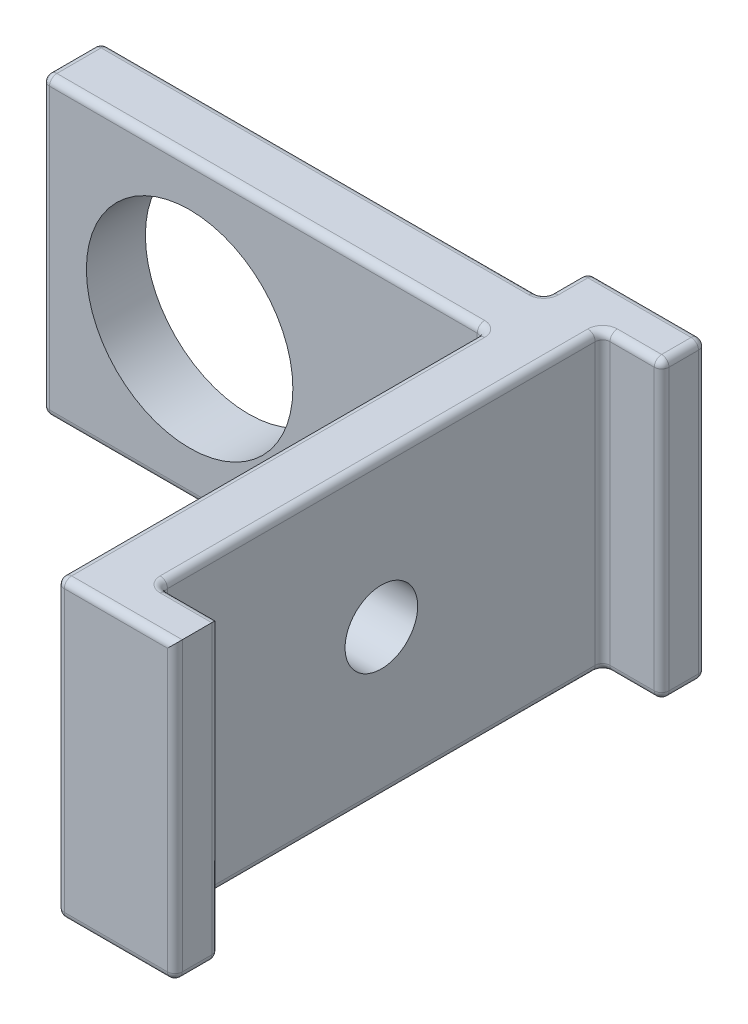
from build123d import *

# Parameters (mm, degrees)
SCHIZZO1_W                   = 30
SCHIZZO1_H                   = 20
SCHIZZO1_R                   = 7
ESTRUSIONE_ESTRUSIONE1_DEPTH = 4
SCHIZZO2_W                   = 4
SCHIZZO2_H                   = 20
ESTRUSIONE_ESTRUSIONE2_DEPTH = 30
SCHIZZO3_W                   = 8
SCHIZZO3_H                   = 20
ESTRUSIONE_ESTRUSIONE3_DEPTH = 3
SCHIZZO4_W                   = 8
SCHIZZO4_H                   = 20
ESTRUSIONE_ESTRUSIONE4_DEPTH = 3
RACCORDO1_R                  = 0.5
RACCORDO2_R                  = 0.5
RACCORDO3_R                  = 0.5
RACCORDO4_R                  = 0.5
RACCORDO5_R                  = 0.5
SCHIZZO5_R                   = 2.462201362
TAGLIO_ESTRUSIONE1_DEPTH     = 5


with BuildPart() as part:
    # Schizzo1 → Estrusione-Estrusione1 (new body)
    with BuildSketch(Plane.XY):
        with Locations((5, 0)):
            Rectangle(SCHIZZO1_W, SCHIZZO1_H)
        Circle(SCHIZZO1_R, mode=Mode.SUBTRACT)
    extrude(amount=ESTRUSIONE_ESTRUSIONE1_DEPTH)

    # Schizzo2 → Estrusione-Estrusione2 (add)
    with BuildSketch(Plane(origin=(0, 0, 0), x_dir=(-1, 0, 0), z_dir=(0, 0, -1))):
        with Locations((-22, 0)):
            Rectangle(SCHIZZO2_W, SCHIZZO2_H)
    extrude(amount=-ESTRUSIONE_ESTRUSIONE2_DEPTH)

    # Schizzo3 → Estrusione-Estrusione3 (add)
    with BuildSketch(Plane.XY.offset(30)):
        with Locations((24, 0)):
            Rectangle(SCHIZZO3_W, SCHIZZO3_H)
    extrude(amount=ESTRUSIONE_ESTRUSIONE3_DEPTH)

    # Schizzo4 → Estrusione-Estrusione4 (add)
    with BuildSketch(Plane(origin=(0, 0, 0), x_dir=(-1, 0, 0), z_dir=(0, 0, -1))):
        with Locations((-24, 0)):
            Rectangle(SCHIZZO4_W, SCHIZZO4_H)
    extrude(amount=ESTRUSIONE_ESTRUSIONE4_DEPTH)

    # Raccordo1
    raccordo1_edges = [part.edges().sort_by_distance(p)[0] for p in [
        (20, 0, 4),
        (20, 0, 0),
        (24, 0, 0),
        (24, 0, 30),
    ]]
    fillet(raccordo1_edges, radius=RACCORDO1_R)

    # Raccordo2
    raccordo2_edges = [part.edges().sort_by_distance(p)[0] for p in [
        (4.75, -10, 0),
        (20, -10, -1.75),
        (4.75, 10, 0),
        (19.853553391, 10, -0.146446609),
        (19.853553391, -10, -0.146446609),
        (28, 0, 0),
        (20, 10, -1.75),
    ]]
    fillet(raccordo2_edges, radius=RACCORDO2_R)

    # Raccordo3
    raccordo3_edges = [part.edges().sort_by_distance(p)[0] for p in [
        (26.25, -10, 30),
        (24, -10, 15),
        (28, -10, -1.75),
        (27.853553391, -10, -0.146446609),
        (24.146446609, -10, 29.853553391),
        (24.146446609, -10, 0.146446609),
        (26, -10, 0),
    ]]
    fillet(raccordo3_edges, radius=RACCORDO3_R)

    # Raccordo4
    raccordo4_edges = [part.edges().sort_by_distance(p)[0] for p in [
        (28, 0.25, 30),
        (28, -9.853553391, 30.146446609),
        (28, -10, 31.75),
        (26.25, 10, 30),
        (24, 10, 15),
        (28, 10, -1.75),
        (27.853553391, 10, -0.146446609),
        (24.146446609, 10, 29.853553391),
        (24.146446609, 10, 0.146446609),
        (26, 10, 0),
    ]]
    fillet(raccordo4_edges, radius=RACCORDO4_R)

    # Raccordo5
    raccordo5_edges = [part.edges().sort_by_distance(p)[0] for p in [
        (20.146446609, -9.853553391, -3),
        (-10, -9.853553391, 0.146446609),
        (19.853553391, -10, 4.146446609),
        (24, -10, -3),
        (20, 0, -3),
        (24, 10, -3),
        (20, 0, 33),
        (24, 10, 33),
        (23.75, -10, 33),
        (20, 10, 18.75),
        (19.853553391, 10, 4.146446609),
        (20, -10, 18.75),
        (-10, 0, 0),
        (-10, 0, 4),
        (4.75, -10, 4),
        (4.75, 10, 4),
        (20.146446609, 9.853553391, -3),
        (-10, 9.853553391, 0.146446609),
        (28, 0.25, 33),
        (27.853553391, -9.853553391, 33),
        (-10, -10, 2.25),
        (-10, 10, 2.25),
        (27.853553391, -9.853553391, -3),
        (28, 0, -3),
        (27.853553391, 9.853553391, -3),
    ]]
    fillet(raccordo5_edges, radius=RACCORDO5_R)

    # Schizzo5 → Taglio-Estrusione1 (cut)
    with BuildSketch(Plane(origin=(24, 0, 0), x_dir=(0, 0, -1), z_dir=(1, 0, 0))):
        with Locations((-15, 0)):
            Circle(SCHIZZO5_R)
    extrude(amount=-TAGLIO_ESTRUSIONE1_DEPTH, mode=Mode.SUBTRACT)


solid = part.part
